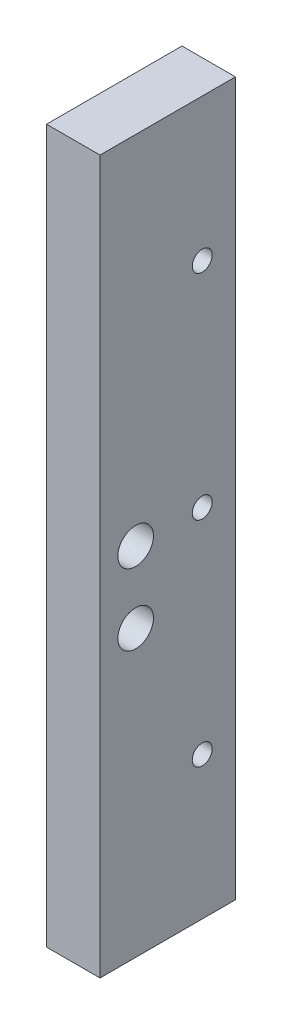
from build123d import *

# Parameters (mm, degrees)
SKETCH1_W           = 9.525
SKETCH1_H           = 127
BOSS_EXTRUDE1_DEPTH = 24.13
SKETCH2_R           = 1.778
CUT_EXTRUDE1_DEPTH  = 130.622461499
SKETCH3_R           = 3.175
CUT_EXTRUDE2_DEPTH  = 38.1


with BuildPart() as part:
    # Sketch1 → Boss-Extrude1 (new body)
    with BuildSketch(Plane.XY):
        with Locations((4.7625, 63.5)):
            Rectangle(SKETCH1_W, SKETCH1_H)
    extrude(amount=BOSS_EXTRUDE1_DEPTH)

    # Sketch2 → Cut-Extrude1 (cut, through all)
    with BuildSketch(Plane.ZY):
        with Locations((5.9182, 101.6)):
            Circle(SKETCH2_R)
        with Locations((5.9182, 63.5)):
            Circle(SKETCH2_R)
        with Locations((5.9182, 25.4)):
            Circle(SKETCH2_R)
    extrude(amount=-CUT_EXTRUDE1_DEPTH, mode=Mode.SUBTRACT)

    # Sketch3 → Cut-Extrude2 (cut)
    with BuildSketch(Plane(origin=(9.525, 0, 0), x_dir=(0, 0, -1), z_dir=(1, 0, 0))):
        with Locations((-17.78, 63.5)):
            Circle(SKETCH3_R)
        with Locations((-17.78, 50.8)):
            Circle(SKETCH3_R)
    extrude(amount=-CUT_EXTRUDE2_DEPTH, mode=Mode.SUBTRACT)


solid = part.part
